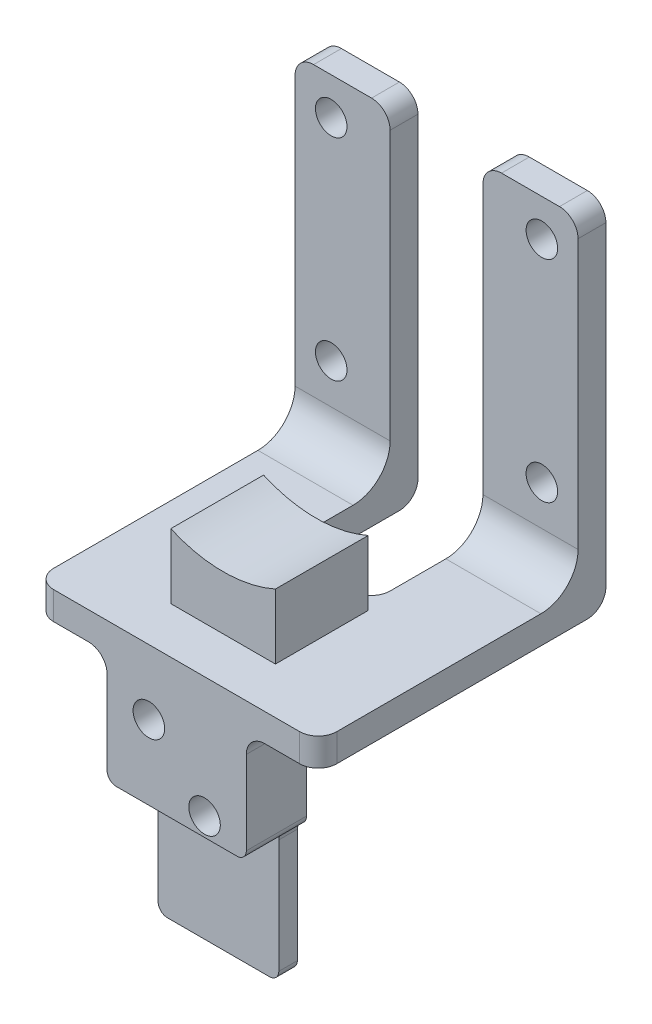
from build123d import *

# Parameters (mm, degrees)
BOSS_EXTRUDE1_DEPTH      = 3
BOSS_EXTRUDE2_DEPTH      = 35
BOSS_EXTRUDE2_DEPTH_BACK = 3
SKETCH3_W                = 10.25
SKETCH3_H                = 3
SKETCH4_W                = 15
SKETCH4_H                = 6.5
BOSS_EXTRUDE3_DEPTH      = 12
M3_CLEARANCE_HOLE1_D     = 3.4
M3_CLEARANCE_HOLE2_D     = 3.4
FILLET1_R                = 1
FILLET2_R                = 2
FILLET3_R                = 1
SKETCH11_W               = 13
SKETCH11_H               = 2
BOSS_EXTRUDE4_DEPTH      = 14
FILLET4_R                = 1
FILLET5_R                = 4
BOSS_EXTRUDE5_START      = -5
BOSS_EXTRUDE5_DEPTH      = 10


with BuildPart() as part:
    # Sketch2 → Boss-Extrude1 (new body)
    with BuildSketch(Plane(origin=(0, 0, 0), x_dir=(1, 0, 0), z_dir=(0, 1, 0))):
        Polygon((-15.25, -14), (15.25, -14), (15.25, 14), (5, 14), (5, 2), (-5, 2), (-5, 14), (-15.25, 14), align=None)
    extrude(amount=BOSS_EXTRUDE1_DEPTH)

    # Sketch3 → Boss-Extrude2 (add, two sides: drawn at the far end of the back side and taken through both)
    with BuildSketch(Plane(origin=(0, 3, 0), x_dir=(1, 0, 0), z_dir=(0, 1, 0)).offset(-BOSS_EXTRUDE2_DEPTH_BACK)):
        with Locations((-10.125, 15.5)):
            Rectangle(SKETCH3_W, SKETCH3_H)
        with Locations((10.125, 15.5)):
            Rectangle(SKETCH3_W, SKETCH3_H)
    extrude(amount=BOSS_EXTRUDE2_DEPTH + BOSS_EXTRUDE2_DEPTH_BACK)

    # Sketch4 → Boss-Extrude3 (add)
    with BuildSketch(Plane.XZ):
        with Locations((0, 10.75)):
            Rectangle(SKETCH4_W, SKETCH4_H)
    extrude(amount=BOSS_EXTRUDE3_DEPTH)

    # M3 Clearance Hole1 (through all)
    with Locations(Plane.XY.offset(14)):
        with Locations((-3, -4), (3, -10)):
            Hole(M3_CLEARANCE_HOLE1_D / 2)

    # M3 Clearance Hole2 (through all)
    with Locations(Plane.XY.offset(-14)):
        with Locations((-11.34906384, 34), (11.34906384, 34), (11.34906384, 11.30187232), (-11.34906384, 11.30187232)):
            Hole(M3_CLEARANCE_HOLE2_D / 2)

    # Fillet1
    fillet1_edges = [part.edges().sort_by_distance(p)[0] for p in [
        (-7.5, -12, 10.75),
        (7.5, -12, 10.75),
    ]]
    fillet(fillet1_edges, radius=FILLET1_R)

    # Fillet2
    fillet2_edges = [part.edges().sort_by_distance(p)[0] for p in [
        (15.25, 1.5, 14),
        (-15.25, 1.5, 14),
        (-5, 1.5, -2),
        (5, 1.5, -2),
        (-15.25, 38, -15.5),
        (-5, 38, -15.5),
        (-10.125, 0, -17),
        (15.25, 38, -15.5),
        (5, 38, -15.5),
        (10.125, 0, -17),
        (-7.5, 0, 10.75),
        (7.5, 0, 10.75),
    ]]
    fillet(fillet2_edges, radius=FILLET2_R)

    # Fillet3
    fillet3_edges = [part.edges().sort_by_distance(p)[0] for p in [
        (0, 0, 7.5),
    ]]
    fillet(fillet3_edges, radius=FILLET3_R - 0.0001)  # a hair under: the kernel refuses the full size

    # Sketch11 → Boss-Extrude4 (add)
    with BuildSketch(Plane.XZ.offset(12)):
        with Locations((0, 8.5)):
            Rectangle(SKETCH11_W, SKETCH11_H)
    extrude(amount=BOSS_EXTRUDE4_DEPTH)

    # Fillet4
    fillet4_edges = [part.edges().sort_by_distance(p)[0] for p in [
        (-6.5, -12, 8.5),
        (-6.5, -26, 8.5),
        (6.5, -26, 8.5),
        (6.5, -12, 8.5),
    ]]
    fillet(fillet4_edges, radius=FILLET4_R)

    # Fillet5
    fillet5_edges = [part.edges().sort_by_distance(p)[0] for p in [
        (-10.125, 3, -14),
        (10.125, 3, -14),
    ]]
    fillet(fillet5_edges, radius=FILLET5_R)

    # Sketch13 → Boss-Extrude5 (add)
    with BuildSketch(Plane.XY.offset(14).offset(BOSS_EXTRUDE5_START)):
        with BuildLine():
            Line((-5.637048368, 10), (-5.637048368, 3))
            Line((-5.637048368, 3), (5.637048368, 3))
            Line((5.637048368, 3), (5.637048368, 10))
            ThreePointArc((5.637048368, 10), (0, 8.800936159), (-5.637048368, 10))
        make_face()
    extrude(amount=-BOSS_EXTRUDE5_DEPTH)


solid = part.part
